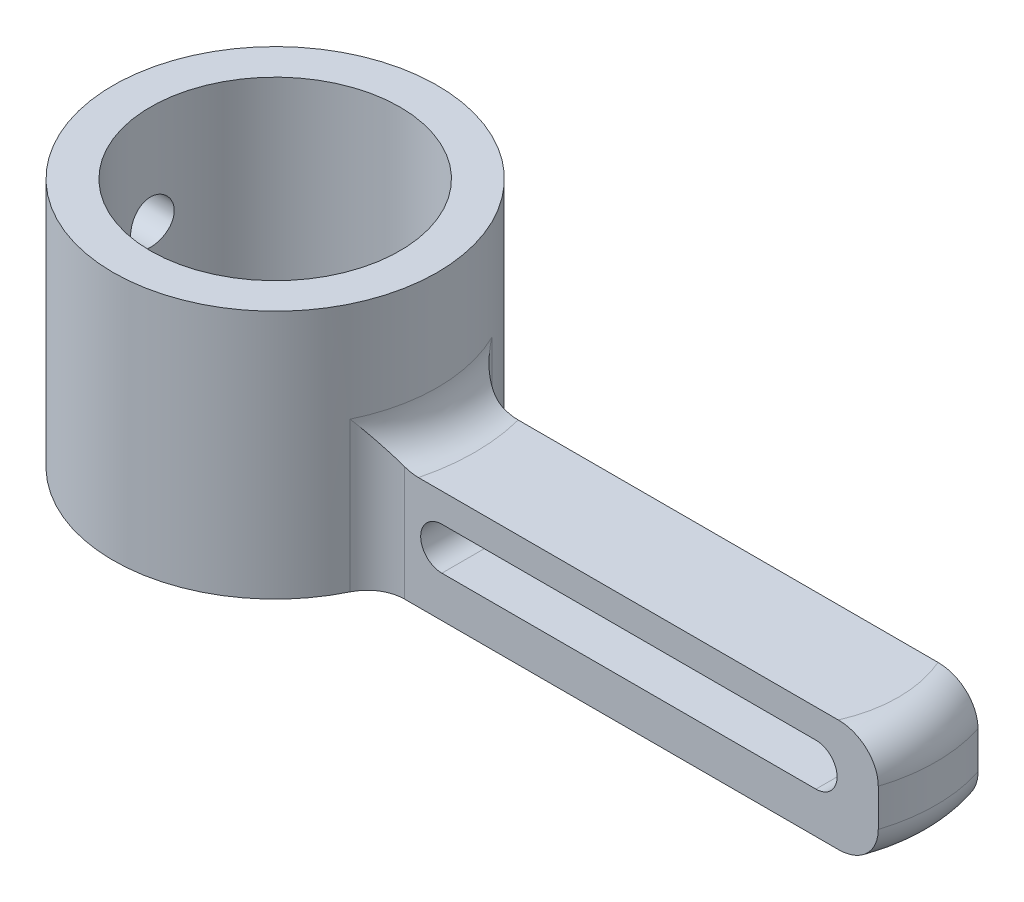
from build123d import *

# Parameters (mm, degrees)
SKETCH_1_R          = 13
SKETCH_1_R_2        = 10
EXTRUDE_1_DEPTH     = 20
EXTRUDE_2_DEPTH     = 9
CUT_EXTRUDE_1_DEPTH = 60.14389233
FILLET_1_R          = 3
SKETCH_4_R          = 1.75
CUT_EXTRUDE_2_DEPTH = 59.120564438


# Read off the part's stored shape, not the designer's step: 凸台-拉伸2
with BuildPart() as part:
    # 草图1 → 凸台-拉伸1 (new body)
    with BuildSketch(Plane(origin=(0, 0, 0), x_dir=(1, 0, 0), z_dir=(0, 1, 0))):
        with Locations(Location((0, 0, 0), (0, 0, 270))):
            Circle(SKETCH_1_R)
        with Locations(Location((0, 0, 0), (0, 0, 270))):
            Circle(SKETCH_1_R_2, mode=Mode.SUBTRACT)
    extrude(amount=EXTRUDE_1_DEPTH)

    # 凸台-拉伸2 outline → 凸台-拉伸2 (add)
    with BuildSketch(Plane(origin=(0, 0, 0), x_dir=(1, 0, 0), z_dir=(0, 1, 0))):
        with BuildLine():
            ThreePointArc((52.369316877, -4), (53, 0), (52.369316877, 4))
            Line((52.369316877, 4), (12.369316877, 4))
            ThreePointArc((12.369316877, 4), (13, 0), (12.369316877, -4))
            Line((12.369316877, -4), (52.369316877, -4))
        make_face()
    extrude(amount=EXTRUDE_2_DEPTH)

    # 草图3 → 切除-拉伸1 (cut, through all)
    with BuildSketch(Plane.XY.offset(4)):
        with BuildLine():
            Line((17.369316877, 6.7), (47.369316877, 6.7))
            ThreePointArc((47.369316877, 6.7), (49.069316877, 5), (47.369316877, 3.3))
            Line((47.369316877, 3.3), (17.369316877, 3.3))
            ThreePointArc((17.369316877, 3.3), (15.669316877, 5), (17.369316877, 6.7))
        make_face()
    extrude(amount=-CUT_EXTRUDE_1_DEPTH, mode=Mode.SUBTRACT)

    # 圆角1
    fillet_1_edges = [part.edges().sort_by_distance(p)[0] for p in [
        (53, 9, 0),
        (53, 0, 0),
        (12.369316877, 4.5, -4),
        (13, 9, 0),
        (12.369316877, 4.5, 4),
    ]]
    fillet(fillet_1_edges, radius=FILLET_1_R)

    # 草图4 → 切除-拉伸2 (cut, through all)
    with BuildSketch(Plane(origin=(0, 0, 0), x_dir=(0, 0, -1), z_dir=(1, 0, 0))):
        with Locations((0, 12)):
            Circle(SKETCH_4_R)
    extrude(amount=-CUT_EXTRUDE_2_DEPTH, mode=Mode.SUBTRACT)


solid = part.part
